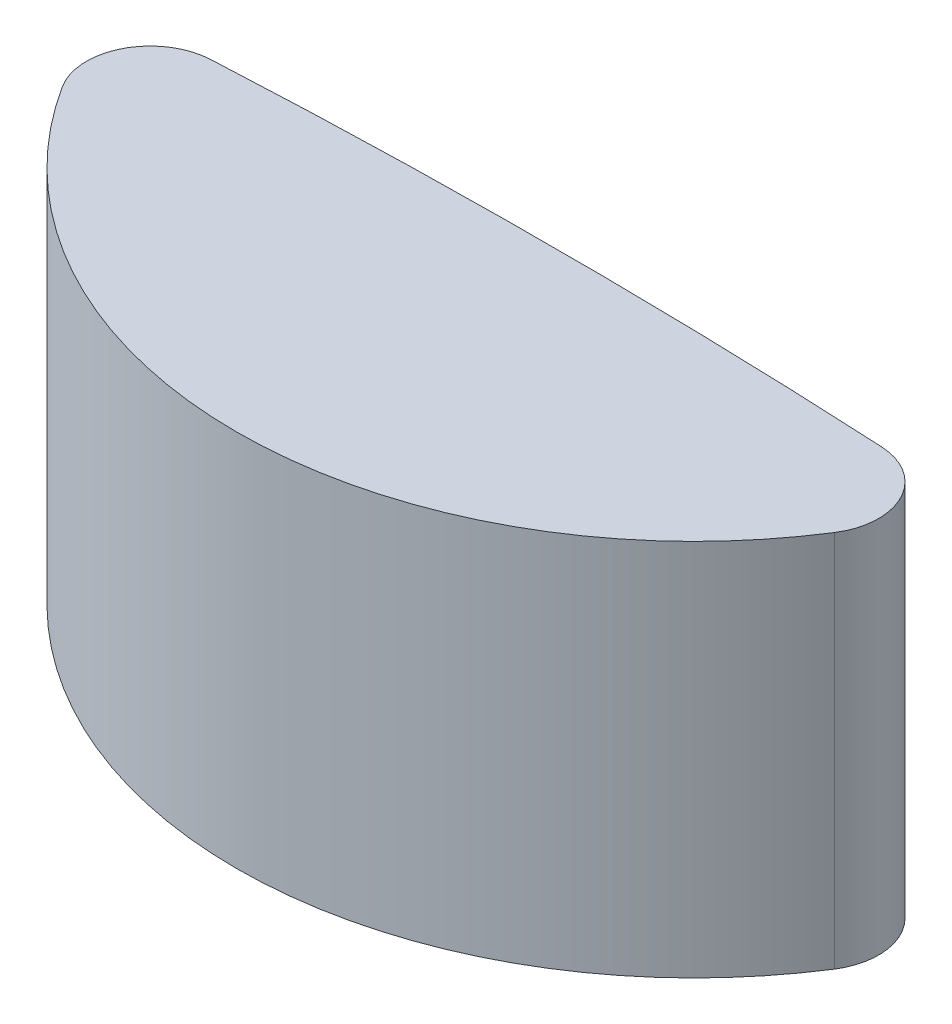
from build123d import *

# Parameters (mm, degrees)
BOSS_EXTRUDE2_DEPTH = 4.826


with BuildPart() as part:
    # Sketch2 → Boss-Extrude2 (new body)
    with BuildSketch(Plane(origin=(0, 0, 0), x_dir=(1, 0, 0), z_dir=(0, 1, 0))):
        with BuildLine():
            ThreePointArc((-4.285409449, 109.404101768), (-4.964968073, 108.965049687), (-4.928136529, 108.15683555))
            ThreePointArc((-4.928136529, 108.15683555), (0, 105.452100976), (4.928136529, 108.15683555))
            ThreePointArc((4.928136529, 108.15683555), (4.964968073, 108.965049687), (4.285409449, 109.404101768))
            ThreePointArc((4.285409449, 109.404101768), (0, 109.516100976), (-4.285409449, 109.404101768))
        make_face()
    extrude(amount=BOSS_EXTRUDE2_DEPTH)


solid = part.part
